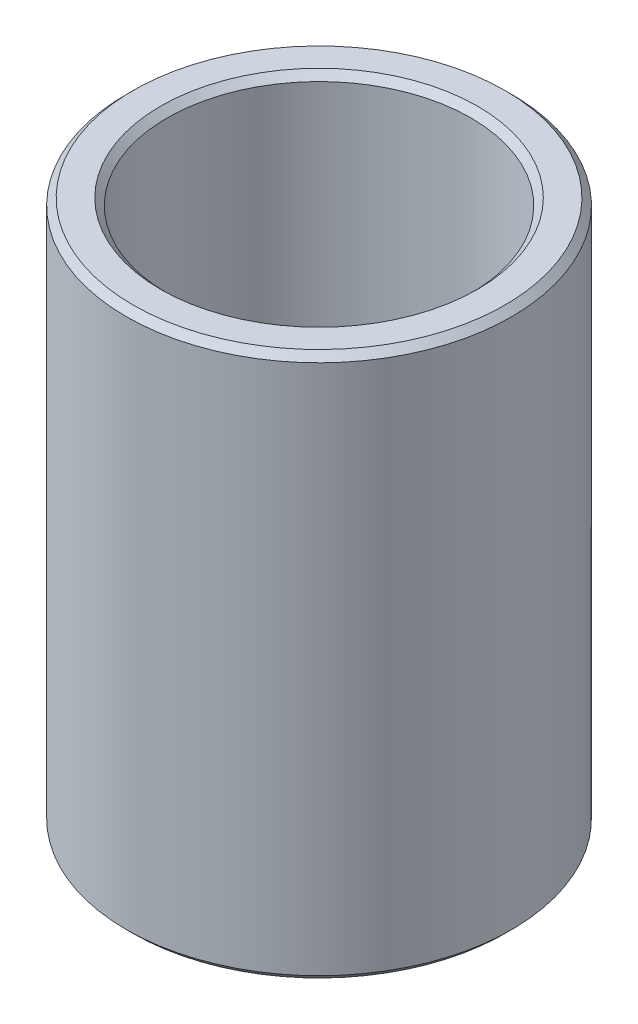
from build123d import *

# Parameters (mm, degrees)
SKETCH1_R           = 20
BOSS_EXTRUDE1_DEPTH = 56.509501764
SKETCH2_R           = 15.765524669
CUT_EXTRUDE1_DEPTH  = 64.192751085
CHAMFER1_SIZE       = 0.699719234


with BuildPart() as part:
    # Sketch1 → Boss-Extrude1 (new body)
    with BuildSketch(Plane(origin=(0, 0, 0), x_dir=(1, 0, 0), z_dir=(0, 1, 0))):
        Circle(SKETCH1_R)
    extrude(amount=BOSS_EXTRUDE1_DEPTH)

    # Sketch2 → Cut-Extrude1 (cut, through all)
    with BuildSketch(Plane(origin=(0, 0, 0), x_dir=(1, 0, 0), z_dir=(0, 1, 0))):
        Circle(SKETCH2_R)
    extrude(amount=CUT_EXTRUDE1_DEPTH, mode=Mode.SUBTRACT)

    # Chamfer1
    chamfer1_edges = [part.edges().sort_by_distance(p)[0] for p in [
        (-15.765524669, 56.509501764, 0),
        (-15.765524669, 0, 0),
        (-20, 0, 0),
        (-20, 56.509501764, 0),
    ]]
    chamfer(chamfer1_edges, length=CHAMFER1_SIZE)


solid = part.part
